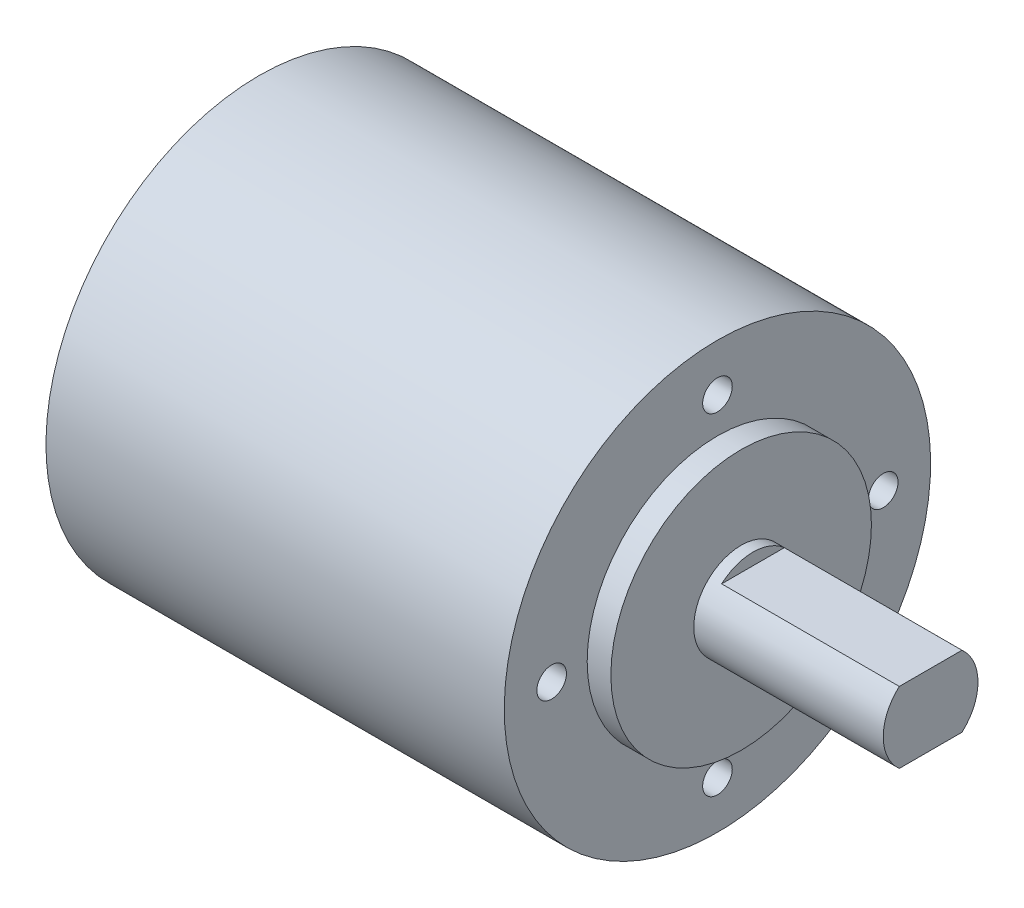
from build123d import *

# Parameters (mm, degrees)
SKIZZE3_W                       = 16
SKIZZE3_H                       = 4
SCHNITT_LINEAR_AUSTRAGEN1_DEPTH = 15
SPIEGELN1_START                 = 41.7
SPIEGELN1_DEPTH                 = 15
KREISMUSTER1_COUNT              = 4


# Read off the part's stored shape, not the designer's step: Spiegeln1
with BuildPart() as part:
    # Skizze2 → Rotation1 (revolve)
    with BuildSketch(Plane.XY):
        Polygon((38.7, 18), (38.7, 11), (40.7, 11), (40.7, 0), (20.35, 0), (20.35, 7.5), (0, 7.5), (0, 18), align=None)
    revolve(axis=Axis((40.7, 0, 0), (-1, 0, 0)))

    # Skizze6 → M3 Gewindebohrung1 (revolve, cut)
    with BuildSketch(Plane.ZX.offset(14)):
        Polygon((0, 0), (0, 5.751075774), (1.25, 5), (1.25, 0), align=None)
    m3_gewindebohrung1 = revolve(axis=Axis((-6.35, 14, 0), (1, 0, 0)), mode=Mode.SUBTRACT)

    # Skizze8 → M3 Gewindebohrung2 (revolve, cut)
    with BuildSketch(Plane(origin=(38.7, 14, 0), x_dir=(0, 0, -1), z_dir=(0, 1, 0))):
        Polygon((0, 0), (0, 5.751075774), (1.25, 5), (1.25, 0), align=None)
    m3_gewindebohrung2 = revolve(axis=Axis((45.05, 14, 0), (-1, 0, 0)), mode=Mode.SUBTRACT)

    # Kreismuster1: M3 Gewindebohrung1, M3 Gewindebohrung2 ×4 about axis
    kreismuster1_axis = Axis((0, 0, 0), (1, 0, 0))
    add([m3_gewindebohrung1.rotate(kreismuster1_axis, i * 360 / KREISMUSTER1_COUNT) for i in range(1, KREISMUSTER1_COUNT)], mode=Mode.SUBTRACT)
    add([m3_gewindebohrung2.rotate(kreismuster1_axis, i * 360 / KREISMUSTER1_COUNT) for i in range(1, KREISMUSTER1_COUNT)], mode=Mode.SUBTRACT)


with BuildPart() as body_2:
    # Skizze3 → Rotation2 (revolve)
    with BuildSketch(Plane.XY):
        with Locations((48.7, 2)):
            Rectangle(SKIZZE3_W, SKIZZE3_H)
    revolve(axis=Axis((56.7, 0, 0), (-1, 0, 0)))

    # Skizze4 → Schnitt-Linear austragen1 (cut)
    with BuildSketch(Plane(origin=(56.7, 0, 0), x_dir=(0, 0, -1), z_dir=(1, 0, 0))):
        with BuildLine():
            Line((-2.645751311, 3), (0, 3))
            Line((0, 3), (0, 4))
            ThreePointArc((0, 4), (-1.414213562, 3.741657387), (-2.645751311, 3))
        make_face()
    extrude(amount=-SCHNITT_LINEAR_AUSTRAGEN1_DEPTH, mode=Mode.SUBTRACT)

    # Spiegeln1 outline → Spiegeln1 (cut)
    with BuildSketch(Plane.YZ.offset(SPIEGELN1_START)):
        with BuildLine():
            Line((4, 0), (3, 0))
            Line((3, 0), (3, -2.645751311))
            ThreePointArc((3, -2.645751311), (3.741657387, -1.414213562), (4, 0))
        make_face()
        with BuildLine():
            Line((-3, -2.645751311), (-3, 2.645751311))
            ThreePointArc((-3, 2.645751311), (-4, 0), (-3, -2.645751311))
        make_face()
    extrude(amount=SPIEGELN1_DEPTH, mode=Mode.SUBTRACT)


solid = Compound([part.part, body_2.part])
